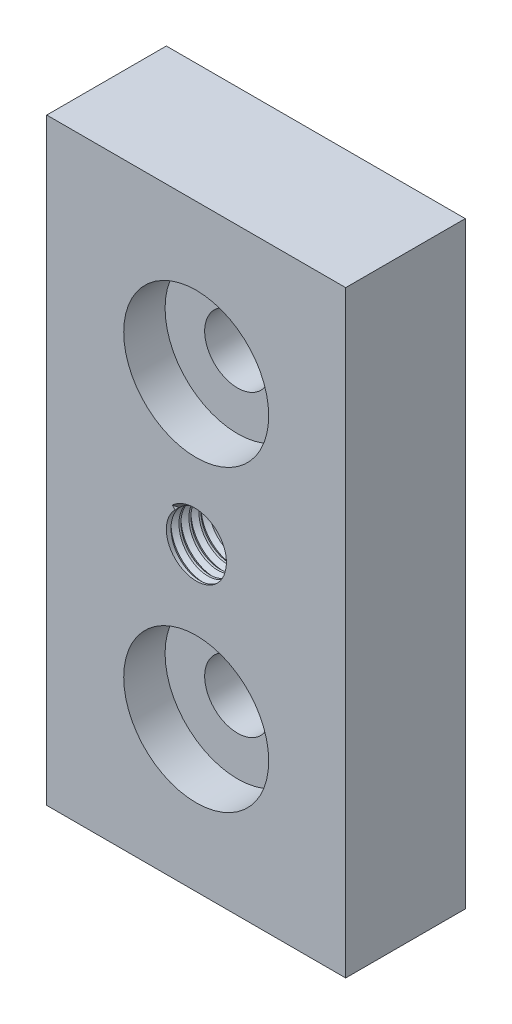
from build123d import *

# Parameters (mm, degrees)
SKETCH_1_W                   = 30
SKETCH_1_H                   = 60
EXTRUDE_1_DEPTH              = 12
HOLE_WIZARD_M6_1_D           = 6.6
HOLE_WIZARD_M6_1_CBORE_D     = 14.55
HOLE_WIZARD_M6_1_CBORE_DEPTH = 4.15
SKETCH_6_R                   = 3
CUT_EXTRUDE_1_DEPTH          = 36.623026261
SWEEP_1_PITCH                = 1


with BuildPart() as part:
    # 草图1 → 凸台-拉伸1 (new body)
    with BuildSketch(Plane.XY):
        Rectangle(SKETCH_1_W, SKETCH_1_H)
    extrude(amount=EXTRUDE_1_DEPTH)

    # M6 六角头螺钉的柱形沉头孔1 (through all)
    with Locations(Plane.XY.offset(12)):
        with Locations((0, 15), (0, -15)):
            CounterBoreHole(HOLE_WIZARD_M6_1_D / 2, HOLE_WIZARD_M6_1_CBORE_D / 2, HOLE_WIZARD_M6_1_CBORE_DEPTH)

    # 草图6 → 切除-拉伸1 (cut, through all)
    with BuildSketch(Plane.XY.offset(12)):
        Circle(SKETCH_6_R)
    extrude(amount=-CUT_EXTRUDE_1_DEPTH, mode=Mode.SUBTRACT)

    # 切除-扫描1: arcs per turn and ends read off the stored shape
    # 切除-扫描1: the profile of 草图8 profile screwed along a right-hand helix through 12 turns, 8 arcs to a turn; built about Z, then put on its axis
    sweep_1_z = Axis((0, 0, 0), (0, 0, 1))
    sweep_1_corners = [(2.9997, 0, 0.400300015), (2.9997, 0, -0.400299985), (3.4, 0, 1.5e-08)]
    with BuildLine(mode=Mode.PRIVATE) as sweep_1_profile:
        Line(sweep_1_corners[0], sweep_1_corners[1])
        Line(sweep_1_corners[1], sweep_1_corners[2])
        Line(sweep_1_corners[2], sweep_1_corners[0])
    sweep_1_cap = Face(sweep_1_profile.wire())
    sweep_1_turn_angles = [0, 22.5, 45, 67.5, 90, 112.5, 135, 157.5, 180, 202.5, 225, 247.5, 270, 292.5, 315, 337.5, 360]
    sweep_1_turn_weights = [1, 0.9238795325112867, 1, 0.9238795325112867, 1, 0.9238795325112867, 1, 0.9238795325112867, 1, 0.9238795325112867, 1, 0.9238795325112867, 1, 0.9238795325112867, 1, 0.9238795325112867, 1]
    sweep_1_turn_rails = [Edge.make_bspline([Vector(p[0], p[1], 0).rotate(sweep_1_z, sweep_1_turn_angles[k]) / sweep_1_turn_weights[k] + Vector(0, 0, p[2] + SWEEP_1_PITCH * sweep_1_turn_angles[k] / 360) for k in range(17)], [0, 0, 0, 1, 1, 2, 2, 3, 3, 4, 4, 5, 5, 6, 6, 7, 7, 8, 8, 8], 2, sweep_1_turn_weights) for p in sweep_1_corners]
    sweep_1_turn_sides = [Face.make_surface_from_curves(sweep_1_turn_rails[p[0]], sweep_1_turn_rails[p[1]]) for p in [(0, 1), (1, 2), (2, 0)]]
    sweep_1 = Plane(origin=(0, 0, 12), x_dir=(-0.7071067811865512, 0.7071067811865438, 0), z_dir=(0, 0, -1)) * Solid(Shell([*[p.moved(Location((0, 0, SWEEP_1_PITCH * i))) for i in range(12) for p in sweep_1_turn_sides], sweep_1_cap, sweep_1_cap.rotate(sweep_1_z, 4320).moved(Location((0, 0, SWEEP_1_PITCH * 4320 / 360)))]))
    add(sweep_1, mode=Mode.SUBTRACT)


solid = part.part
